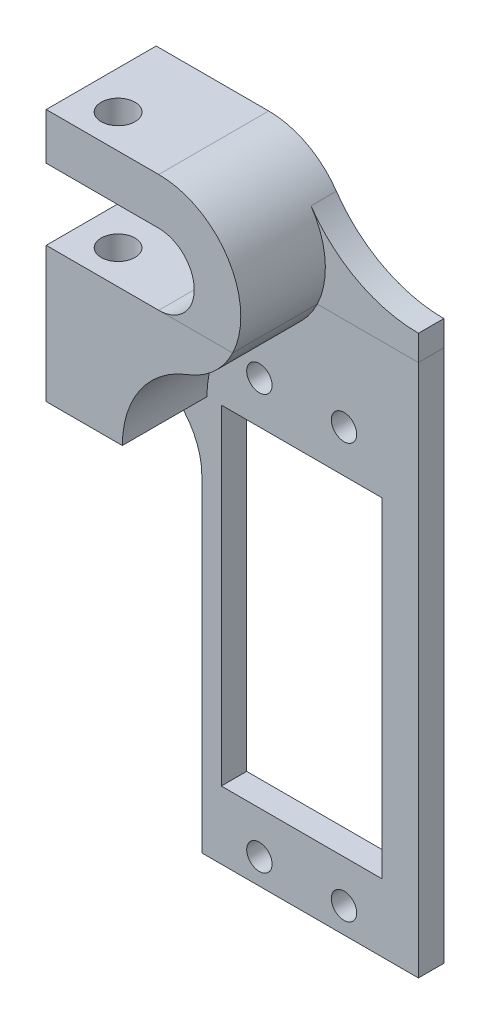
from build123d import *

# Parameters (mm, degrees)
SKETCH_1_R             = 1.5
SKETCH_1_W             = 19
SKETCH_1_H             = 39
EXTRUDE_894_DEPTH      = 3
EXTRUDE_1415_DEPTH     = 10
CUT_EXTRUDE_1608_REACH = 54.783
SKETCH_3_R             = 2


# Read off the part's stored shape, not the designer's step: Разделить1
with BuildPart() as part:
    # Эскиз1 → Extrude 894 (new body)
    with BuildSketch(Plane.XY):
        with BuildLine():
            Line((-20.2, 19.5), (-20.2, 35.5))
            Line((-20.2, 35.5), (-6.9, 35.5))
            ThreePointArc((-6.9, 35.5), (-2.7, 39.7), (-6.9, 43.9))
            Line((-6.9, 43.9), (-20.2, 43.9))
            Line((-20.2, 43.9), (-20.2, 49.4))
            Line((-20.2, 49.4), (-6.9, 49.4))
            ThreePointArc((-6.9, 49.4), (-2.380550811, 48.282807176), (1.097847616, 45.188572995))
            ThreePointArc((1.097847616, 45.188572995), (6.622227297, 40.274321564), (13.8, 38.5))
            Line((13.8, 38.5), (13.8, -27.5))
            Line((13.8, -27.5), (-11.8, -27.5))
            Line((-11.8, -27.5), (-11.8, 11.1))
            ThreePointArc((-11.8, 11.1), (-14.260303038, 17.039696962), (-20.2, 19.5))
        make_face()
        with Locations((-5, 24.5)):
            Circle(SKETCH_1_R, mode=Mode.SUBTRACT)
        with Locations((5, 24.5)):
            Circle(SKETCH_1_R, mode=Mode.SUBTRACT)
        with Locations((-5, -24.5)):
            Circle(SKETCH_1_R, mode=Mode.SUBTRACT)
        with Locations((5, -24.5)):
            Circle(SKETCH_1_R, mode=Mode.SUBTRACT)
        Rectangle(SKETCH_1_W, SKETCH_1_H, mode=Mode.SUBTRACT)
    extrude(amount=EXTRUDE_894_DEPTH)

    # Эскиз2 → Extrude 1415 (add)
    with BuildSketch(Plane.XY.offset(3)):
        with BuildLine():
            Line((-20.2, 19.5), (-20.2, 35.5))
            Line((-20.2, 35.5), (-6.9, 35.5))
            ThreePointArc((-6.9, 35.5), (-2.7, 39.7), (-6.9, 43.9))
            Line((-6.9, 43.9), (-20.2, 43.9))
            Line((-20.2, 43.9), (-20.2, 49.4))
            Line((-20.2, 49.4), (-6.9, 49.4))
            ThreePointArc((-6.9, 49.4), (2.64442991, 41.430276767), (-3.494947354, 30.617290246))
            ThreePointArc((-3.494947354, 30.617290246), (-9.085433797, 26.263171938), (-11.2, 19.5))
            Line((-11.2, 19.5), (-20.2, 19.5))
        make_face()
    extrude(amount=EXTRUDE_1415_DEPTH)

    # Cut-Extrude 1608: up to this face of the body (flat: up to its plane)
    cut_extrude_1608_end = Plane(part.part.faces().sort_by_distance((-13.55, 49.4, 6.5))[0])
    # Эскиз3 → Cut-Extrude 1608 (cut, up to the picked face)
    with BuildSketch(Plane.XZ.offset(-19.5), mode=Mode.PRIVATE) as cut_extrude_1608_sk1:
        with Locations(Location((-15.7, 9, 0), (0, 0, 270))):
            Circle(SKETCH_3_R)
    cut_extrude_1608_tool1 = split(extrude(cut_extrude_1608_sk1.sketch, amount=-CUT_EXTRUDE_1608_REACH, mode=Mode.PRIVATE), bisect_by=cut_extrude_1608_end, keep=Keep.BOTH, mode=Mode.PRIVATE)
    add(cut_extrude_1608_tool1.solids().sort_by(Axis((-15.7, 19.5, 9), (0, 1, 0)))[0], mode=Mode.SUBTRACT)


with BuildPart() as body_2:
    # Split Bodies 1: the piece on the far side of the plane
    add(part.part)
    split(bisect_by=Plane(origin=(0, 35.5, 0), x_dir=(1, 0, 0), z_dir=(0, 1, 0)), keep=Keep.BOTTOM)


with BuildPart() as part_1:
    add(part.part)

    # Split Bodies 1
    split(bisect_by=Plane(origin=(0, 35.5, 0), x_dir=(1, 0, 0), z_dir=(0, 1, 0)), keep=Keep.TOP)


solid = Compound([body_2.part, part_1.part])
